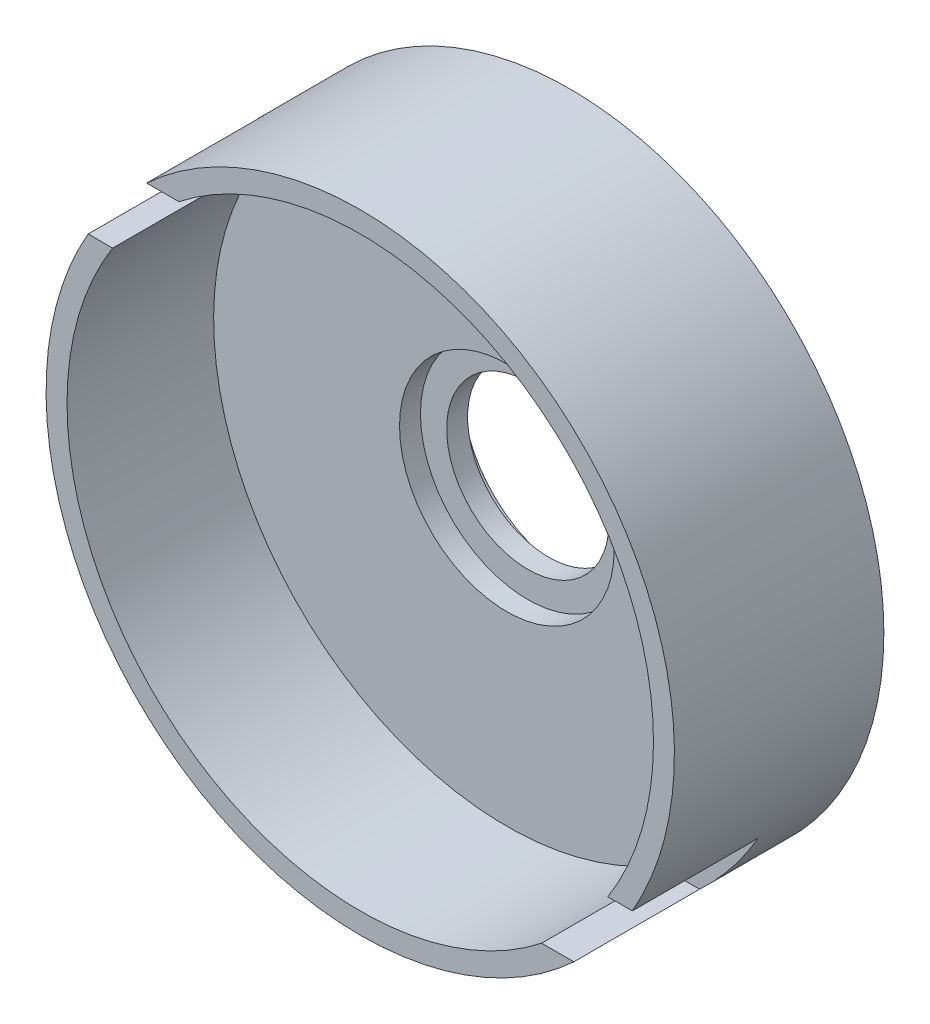
from build123d import *

# Parameters (mm, degrees)
SKETCH_5_R          = 30
EXTRUDE_1_DEPTH     = 20
CUT_EXTRUDE_START   = 6
SKETCH_6_R          = 28
CUT_EXTRUDE_1_DEPTH = 14
SKETCH_7_R          = 7.75
CUT_EXTRUDE_2_DEPTH = 15
CUT_EXTRUDE_START_2 = 4
SKETCH_8_R          = 10.25
CUT_EXTRUDE_3_DEPTH = 16
CUT_EXTRUDE_START_3 = 8
SKETCH_10_W         = 15
SKETCH_10_H         = 7
CUT_EXTRUDE_4_DEPTH = 12
SKETCH_13_W         = 15
SKETCH_13_H         = 7
CUT_EXTRUDE_5_DEPTH = 12
SKETCH_14_R         = 10.25
CUT_EXTRUDE_6_DEPTH = 2


with BuildPart() as part:
    # Эскиз5 → Бобышка-Вытянуть1 (new body)
    with BuildSketch(Plane.XY):
        Circle(SKETCH_5_R)
    extrude(amount=EXTRUDE_1_DEPTH)

    # Эскиз6 → Вырез-Вытянуть1 (cut)
    with BuildSketch(Plane.XY.offset(CUT_EXTRUDE_START)):
        Circle(SKETCH_6_R)
    extrude(amount=CUT_EXTRUDE_1_DEPTH, mode=Mode.SUBTRACT)

    # Эскиз7 → Вырез-Вытянуть2 (cut)
    with BuildSketch(Plane.XY):
        Circle(SKETCH_7_R)
    extrude(amount=CUT_EXTRUDE_2_DEPTH, mode=Mode.SUBTRACT)

    # Эскиз8 → Вырез-Вытянуть3 (cut)
    with BuildSketch(Plane.XY.offset(CUT_EXTRUDE_START_2)):
        Circle(SKETCH_8_R)
    extrude(amount=CUT_EXTRUDE_3_DEPTH, mode=Mode.SUBTRACT)

    # Эскиз10 → Вырез-Вытянуть4 (cut)
    with BuildSketch(Plane.XY.offset(CUT_EXTRUDE_START_3)):
        with Locations((-22.5, 18.5)):
            Rectangle(SKETCH_10_W, SKETCH_10_H)
    extrude(amount=CUT_EXTRUDE_4_DEPTH, mode=Mode.SUBTRACT)

    # Эскиз13 → Вырез-Вытянуть5 (cut)
    with BuildSketch(Plane.XY.offset(CUT_EXTRUDE_START_3)):
        with Locations((22.5, -18.5)):
            Rectangle(SKETCH_13_W, SKETCH_13_H)
    extrude(amount=CUT_EXTRUDE_5_DEPTH, mode=Mode.SUBTRACT)

    # Эскиз14 → Вырез-Вытянуть6 (cut)
    with BuildSketch(Plane.XY):
        Circle(SKETCH_14_R)
    extrude(amount=CUT_EXTRUDE_6_DEPTH, mode=Mode.SUBTRACT)


solid = part.part
